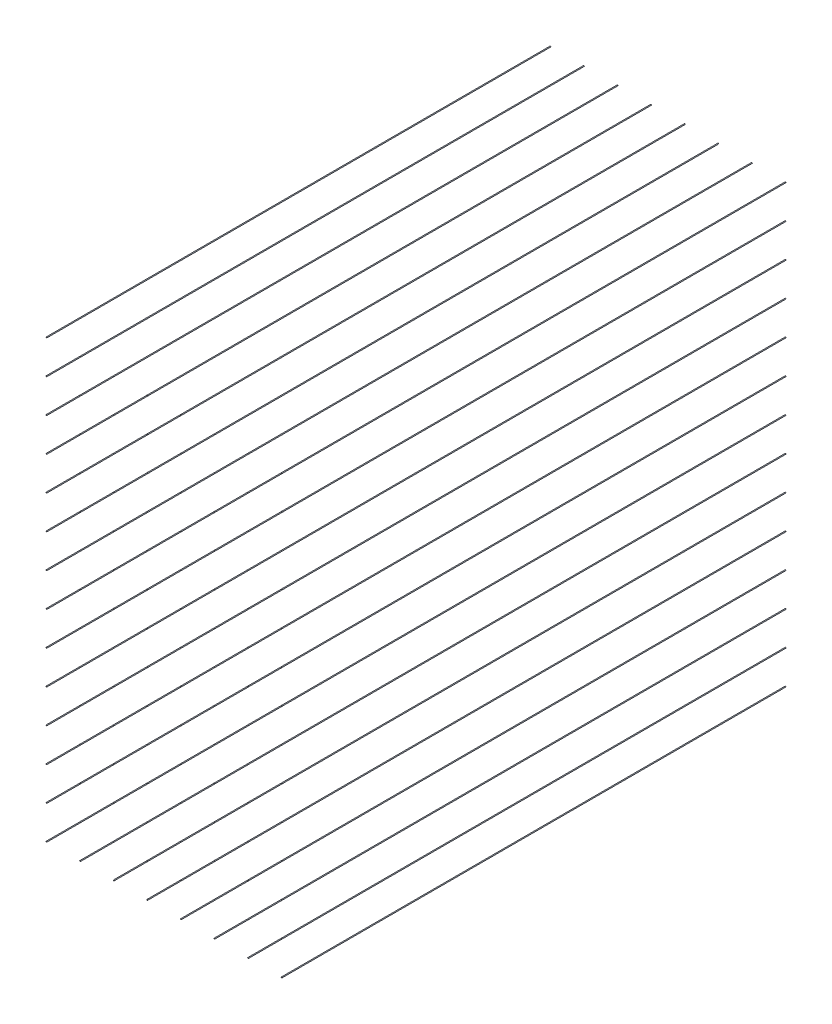
from build123d import *

# Parameters (mm, degrees)
SKETCH1_R           = 0.125
BOSS_EXTRUDE1_DEPTH = 150
LPATTERN1_OUTLINE_R = 0.125
LPATTERN1_DEPTH     = 150


# Read off the part's stored shape, not the designer's step: LPattern1
with BuildPart() as part:
    # Sketch1 → Boss-Extrude1 (new body)
    with BuildSketch(Plane.XY):
        Circle(SKETCH1_R)
    extrude(amount=BOSS_EXTRUDE1_DEPTH)


with BuildPart() as body_2:
    # LPattern1 outline → LPattern1 (new body)
    with BuildSketch(Plane.XY):
        with Locations((70, 130)):
            Circle(LPATTERN1_OUTLINE_R)
        with Locations((60, 130)):
            Circle(LPATTERN1_OUTLINE_R)
        with Locations((50, 130)):
            Circle(LPATTERN1_OUTLINE_R)
        with Locations((40, 130)):
            Circle(LPATTERN1_OUTLINE_R)
        with Locations((30, 130)):
            Circle(LPATTERN1_OUTLINE_R)
        with Locations((20, 130)):
            Circle(LPATTERN1_OUTLINE_R)
        with Locations((10, 130)):
            Circle(LPATTERN1_OUTLINE_R)
        with Locations((0, 130)):
            Circle(LPATTERN1_OUTLINE_R)
        with Locations((70, 120)):
            Circle(LPATTERN1_OUTLINE_R)
        with Locations((60, 120)):
            Circle(LPATTERN1_OUTLINE_R)
        with Locations((50, 120)):
            Circle(LPATTERN1_OUTLINE_R)
        with Locations((40, 120)):
            Circle(LPATTERN1_OUTLINE_R)
        with Locations((30, 120)):
            Circle(LPATTERN1_OUTLINE_R)
        with Locations((20, 120)):
            Circle(LPATTERN1_OUTLINE_R)
        with Locations((10, 120)):
            Circle(LPATTERN1_OUTLINE_R)
        with Locations((0, 120)):
            Circle(LPATTERN1_OUTLINE_R)
        with Locations((70, 110)):
            Circle(LPATTERN1_OUTLINE_R)
        with Locations((60, 110)):
            Circle(LPATTERN1_OUTLINE_R)
        with Locations((50, 110)):
            Circle(LPATTERN1_OUTLINE_R)
        with Locations((40, 110)):
            Circle(LPATTERN1_OUTLINE_R)
        with Locations((30, 110)):
            Circle(LPATTERN1_OUTLINE_R)
        with Locations((20, 110)):
            Circle(LPATTERN1_OUTLINE_R)
        with Locations((10, 110)):
            Circle(LPATTERN1_OUTLINE_R)
        with Locations((0, 110)):
            Circle(LPATTERN1_OUTLINE_R)
        with Locations((70, 100)):
            Circle(LPATTERN1_OUTLINE_R)
        with Locations((60, 100)):
            Circle(LPATTERN1_OUTLINE_R)
        with Locations((50, 100)):
            Circle(LPATTERN1_OUTLINE_R)
        with Locations((40, 100)):
            Circle(LPATTERN1_OUTLINE_R)
        with Locations((30, 100)):
            Circle(LPATTERN1_OUTLINE_R)
        with Locations((20, 100)):
            Circle(LPATTERN1_OUTLINE_R)
        with Locations((10, 100)):
            Circle(LPATTERN1_OUTLINE_R)
        with Locations((0, 100)):
            Circle(LPATTERN1_OUTLINE_R)
        with Locations((70, 90)):
            Circle(LPATTERN1_OUTLINE_R)
        with Locations((60, 90)):
            Circle(LPATTERN1_OUTLINE_R)
        with Locations((50, 90)):
            Circle(LPATTERN1_OUTLINE_R)
        with Locations((40, 90)):
            Circle(LPATTERN1_OUTLINE_R)
        with Locations((30, 90)):
            Circle(LPATTERN1_OUTLINE_R)
        with Locations((20, 90)):
            Circle(LPATTERN1_OUTLINE_R)
        with Locations((10, 90)):
            Circle(LPATTERN1_OUTLINE_R)
        with Locations((0, 90)):
            Circle(LPATTERN1_OUTLINE_R)
        with Locations((70, 80)):
            Circle(LPATTERN1_OUTLINE_R)
        with Locations((60, 80)):
            Circle(LPATTERN1_OUTLINE_R)
        with Locations((50, 80)):
            Circle(LPATTERN1_OUTLINE_R)
        with Locations((40, 80)):
            Circle(LPATTERN1_OUTLINE_R)
        with Locations((30, 80)):
            Circle(LPATTERN1_OUTLINE_R)
        with Locations((20, 80)):
            Circle(LPATTERN1_OUTLINE_R)
        with Locations((10, 80)):
            Circle(LPATTERN1_OUTLINE_R)
        with Locations((0, 80)):
            Circle(LPATTERN1_OUTLINE_R)
        with Locations((70, 70)):
            Circle(LPATTERN1_OUTLINE_R)
        with Locations((60, 70)):
            Circle(LPATTERN1_OUTLINE_R)
        with Locations((50, 70)):
            Circle(LPATTERN1_OUTLINE_R)
        with Locations((40, 70)):
            Circle(LPATTERN1_OUTLINE_R)
        with Locations((30, 70)):
            Circle(LPATTERN1_OUTLINE_R)
        with Locations((20, 70)):
            Circle(LPATTERN1_OUTLINE_R)
        with Locations((10, 70)):
            Circle(LPATTERN1_OUTLINE_R)
        with Locations((0, 70)):
            Circle(LPATTERN1_OUTLINE_R)
        with Locations((70, 60)):
            Circle(LPATTERN1_OUTLINE_R)
        with Locations((60, 60)):
            Circle(LPATTERN1_OUTLINE_R)
        with Locations((50, 60)):
            Circle(LPATTERN1_OUTLINE_R)
        with Locations((40, 60)):
            Circle(LPATTERN1_OUTLINE_R)
        with Locations((30, 60)):
            Circle(LPATTERN1_OUTLINE_R)
        with Locations((20, 60)):
            Circle(LPATTERN1_OUTLINE_R)
        with Locations((10, 60)):
            Circle(LPATTERN1_OUTLINE_R)
        with Locations((0, 60)):
            Circle(LPATTERN1_OUTLINE_R)
        with Locations((70, 50)):
            Circle(LPATTERN1_OUTLINE_R)
        with Locations((60, 50)):
            Circle(LPATTERN1_OUTLINE_R)
        with Locations((50, 50)):
            Circle(LPATTERN1_OUTLINE_R)
        with Locations((40, 50)):
            Circle(LPATTERN1_OUTLINE_R)
        with Locations((30, 50)):
            Circle(LPATTERN1_OUTLINE_R)
        with Locations((20, 50)):
            Circle(LPATTERN1_OUTLINE_R)
        with Locations((10, 50)):
            Circle(LPATTERN1_OUTLINE_R)
        with Locations((0, 50)):
            Circle(LPATTERN1_OUTLINE_R)
        with Locations((70, 40)):
            Circle(LPATTERN1_OUTLINE_R)
        with Locations((60, 40)):
            Circle(LPATTERN1_OUTLINE_R)
        with Locations((50, 40)):
            Circle(LPATTERN1_OUTLINE_R)
        with Locations((40, 40)):
            Circle(LPATTERN1_OUTLINE_R)
        with Locations((30, 40)):
            Circle(LPATTERN1_OUTLINE_R)
        with Locations((20, 40)):
            Circle(LPATTERN1_OUTLINE_R)
        with Locations((10, 40)):
            Circle(LPATTERN1_OUTLINE_R)
        with Locations((0, 40)):
            Circle(LPATTERN1_OUTLINE_R)
        with Locations((70, 30)):
            Circle(LPATTERN1_OUTLINE_R)
        with Locations((60, 30)):
            Circle(LPATTERN1_OUTLINE_R)
        with Locations((50, 30)):
            Circle(LPATTERN1_OUTLINE_R)
        with Locations((40, 30)):
            Circle(LPATTERN1_OUTLINE_R)
        with Locations((30, 30)):
            Circle(LPATTERN1_OUTLINE_R)
        with Locations((20, 30)):
            Circle(LPATTERN1_OUTLINE_R)
        with Locations((10, 30)):
            Circle(LPATTERN1_OUTLINE_R)
        with Locations((0, 30)):
            Circle(LPATTERN1_OUTLINE_R)
        with Locations((70, 20)):
            Circle(LPATTERN1_OUTLINE_R)
        with Locations((60, 20)):
            Circle(LPATTERN1_OUTLINE_R)
        with Locations((50, 20)):
            Circle(LPATTERN1_OUTLINE_R)
        with Locations((40, 20)):
            Circle(LPATTERN1_OUTLINE_R)
        with Locations((30, 20)):
            Circle(LPATTERN1_OUTLINE_R)
        with Locations((20, 20)):
            Circle(LPATTERN1_OUTLINE_R)
        with Locations((10, 20)):
            Circle(LPATTERN1_OUTLINE_R)
        with Locations((0, 20)):
            Circle(LPATTERN1_OUTLINE_R)
        with Locations((70, 10)):
            Circle(LPATTERN1_OUTLINE_R)
        with Locations((60, 10)):
            Circle(LPATTERN1_OUTLINE_R)
        with Locations((50, 10)):
            Circle(LPATTERN1_OUTLINE_R)
        with Locations((40, 10)):
            Circle(LPATTERN1_OUTLINE_R)
        with Locations((30, 10)):
            Circle(LPATTERN1_OUTLINE_R)
        with Locations((20, 10)):
            Circle(LPATTERN1_OUTLINE_R)
        with Locations((10, 10)):
            Circle(LPATTERN1_OUTLINE_R)
        with Locations((0, 10)):
            Circle(LPATTERN1_OUTLINE_R)
        with Locations((70, 0)):
            Circle(LPATTERN1_OUTLINE_R)
        with Locations((60, 0)):
            Circle(LPATTERN1_OUTLINE_R)
        with Locations((50, 0)):
            Circle(LPATTERN1_OUTLINE_R)
        with Locations((40, 0)):
            Circle(LPATTERN1_OUTLINE_R)
        with Locations((30, 0)):
            Circle(LPATTERN1_OUTLINE_R)
        with Locations((20, 0)):
            Circle(LPATTERN1_OUTLINE_R)
        with Locations((10, 0)):
            Circle(LPATTERN1_OUTLINE_R)
    extrude(amount=LPATTERN1_DEPTH)


solid = Compound([part.part, body_2.part])
